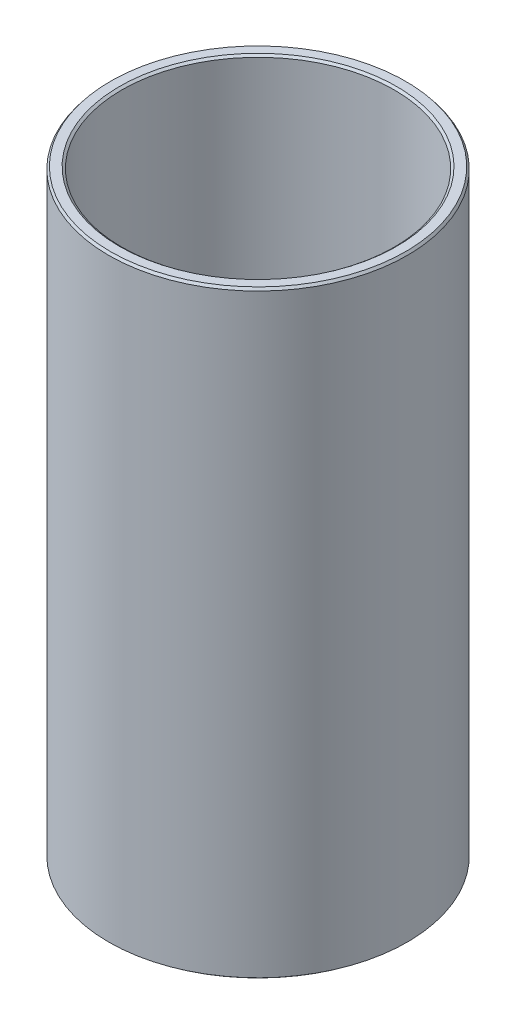
from build123d import *
from OCP.BRepFilletAPI import BRepFilletAPI_MakeChamfer

# Parameters (mm, degrees)
SKETCH1_R           = 57.5
BOSS_EXTRUDE1_DEPTH = 230.529604376
SKETCH2_R           = 52.444548847
CUT_EXTRUDE1_DEPTH  = 245.451219048
CHAMFER1_SIZE       = 0.899703228
CHAMFER1_SIZE2      = 0.69504235


with BuildPart() as part:
    # Sketch1 → Boss-Extrude1 (new body)
    with BuildSketch(Plane(origin=(0, 0, 0), x_dir=(1, 0, 0), z_dir=(0, 1, 0))):
        Circle(SKETCH1_R)
    extrude(amount=BOSS_EXTRUDE1_DEPTH)

    # Sketch2 → Cut-Extrude1 (cut, through all)
    with BuildSketch(Plane(origin=(0, 0, 0), x_dir=(1, 0, 0), z_dir=(0, 1, 0))):
        Circle(SKETCH2_R)
    extrude(amount=CUT_EXTRUDE1_DEPTH, mode=Mode.SUBTRACT)

    # Chamfer1: one chamfer whose edges measure the first distance from different faces: ONE call of the kernel's chamfer builder (chamfer() names one face for all edges)
    chamfer1_edges_1 = [part.edges().sort_by_distance(p)[0] for p in [
        (-52.444548847, 230.529604376, 0),
    ]]
    chamfer1_side_1 = [part.faces().sort_by_distance(p)[0] for p in [
        (-55.873654403, 230.529604376, 0),
    ]]
    chamfer1_edges_2 = [part.edges().sort_by_distance(p)[0] for p in [
        (-52.444548847, 0, 0),
    ]]
    chamfer1_side_2 = [part.faces().sort_by_distance(p)[0] for p in [
        (-52.444548847, 115.264802188, 0),
    ]]
    chamfer1_edges_3 = [part.edges().sort_by_distance(p)[0] for p in [
        (-57.5, 0, 0),
    ]]
    chamfer1_side_3 = [part.faces().sort_by_distance(p)[0] for p in [
        (-55.873654403, 0, 0),
    ]]
    chamfer1_edges_4 = [part.edges().sort_by_distance(p)[0] for p in [
        (-57.5, 230.529604376, 0),
    ]]
    chamfer1_side_4 = [part.faces().sort_by_distance(p)[0] for p in [
        (-57.5, 115.264802188, 0),
    ]]
    chamfer1 = BRepFilletAPI_MakeChamfer(part.part.solid().wrapped)
    for e in chamfer1_edges_1:
        chamfer1.Add(CHAMFER1_SIZE, CHAMFER1_SIZE2, e.wrapped, chamfer1_side_1[0].wrapped)  # the first distance lies on this face
    for e in chamfer1_edges_2:
        chamfer1.Add(CHAMFER1_SIZE, CHAMFER1_SIZE2, e.wrapped, chamfer1_side_2[0].wrapped)  # the first distance lies on this face
    for e in chamfer1_edges_3:
        chamfer1.Add(CHAMFER1_SIZE, CHAMFER1_SIZE2, e.wrapped, chamfer1_side_3[0].wrapped)  # the first distance lies on this face
    for e in chamfer1_edges_4:
        chamfer1.Add(CHAMFER1_SIZE, CHAMFER1_SIZE2, e.wrapped, chamfer1_side_4[0].wrapped)  # the first distance lies on this face
    add(Compound.cast(chamfer1.Shape()), mode=Mode.REPLACE)


solid = part.part
